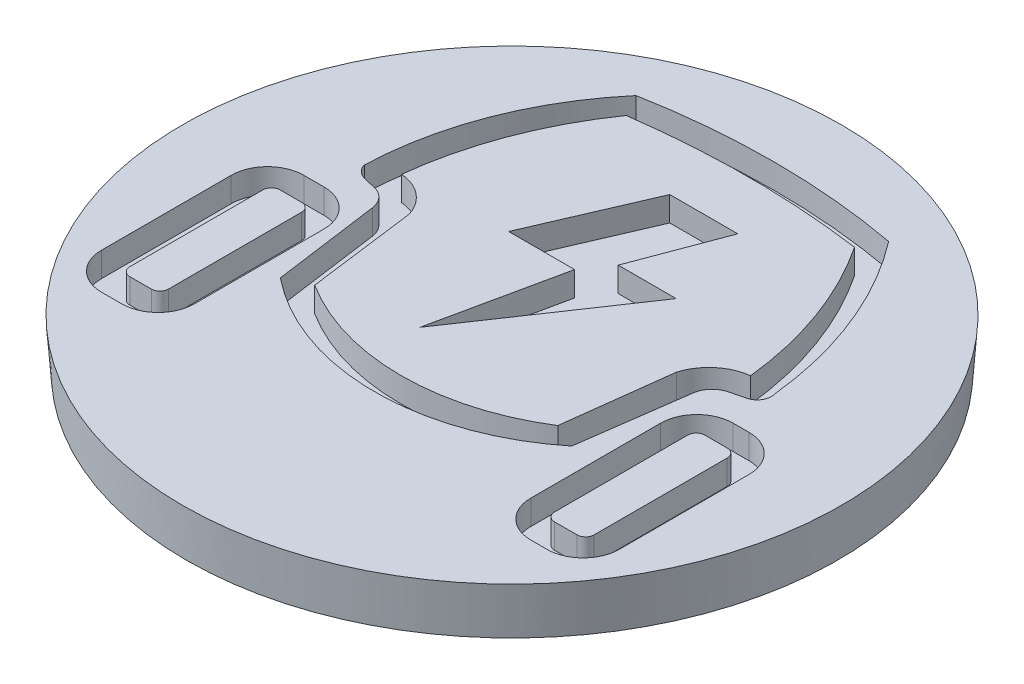
from build123d import *

# Parameters (mm, degrees)
CROQUIS1_R              = 26.25
SALIENTE_EXTRUIR1_DEPTH = 4
CORTAR_EXTRUIR2_DEPTH   = 2
CROQUIS3_R              = 26.75
CROQUIS3_R_2            = 26.25
SALIENTE_EXTRUIR2_DEPTH = 4
CHAFL_N2_SIZE           = 0.3
CHAFL_N2_SIZE_2         = 4


with BuildPart() as part:
    # Croquis1 → Saliente-Extruir1 (new body)
    with BuildSketch(Plane(origin=(0, 0, 0), x_dir=(1, 0, 0), z_dir=(0, 1, 0))):
        with Locations(Location((0, 0, 0), (0, 0, 270))):
            Circle(CROQUIS1_R)
    extrude(amount=SALIENTE_EXTRUIR1_DEPTH)

    # Croquis2 → Cortar-Extruir2 (cut)
    # profile 1 of 4: a face of its own
    with BuildSketch(Plane(origin=(0, 4, 0), x_dir=(1, 0, 0), z_dir=(0, 1, 0))):
        with BuildLine():
            Line((16.577628019, 1.378684251), (17.872942997, 1.378684251))
            ThreePointArc((17.872942997, 1.378684251), (19.958908001, 0.514649256), (20.822942997, -1.571315749))
            Line((20.822942997, -1.571315749), (20.822942997, -12.099082076))
            ThreePointArc((20.822942997, -12.099082076), (19.958908001, -14.18504708), (17.872942997, -15.049082076))
            Line((17.872942997, -15.049082076), (16.577628019, -15.049082076))
            ThreePointArc((16.577628019, -15.049082076), (14.491663014, -14.18504708), (13.627628019, -12.099082076))
            Line((13.627628019, -12.099082076), (13.627628019, -1.571315749))
            ThreePointArc((13.627628019, -1.571315749), (14.491663014, 0.514649256), (16.577628019, 1.378684251))
        make_face()
        with BuildLine():
            ThreePointArc((16.26679092, -0.611177343), (15.771816174, -0.816202597), (15.56679092, -1.311177343))
            Line((15.56679092, -1.311177343), (15.56679092, -12.108932122))
            ThreePointArc((15.56679092, -12.108932122), (15.771816174, -12.603906869), (16.26679092, -12.808932122))
            Line((16.26679092, -12.808932122), (18.08171889, -12.808932122))
            ThreePointArc((18.08171889, -12.808932122), (18.576693636, -12.603906869), (18.78171889, -12.108932122))
            Line((18.78171889, -12.108932122), (18.78171889, -1.311177343))
            ThreePointArc((18.78171889, -1.311177343), (18.576693636, -0.816202597), (18.08171889, -0.611177343))
            Line((18.08171889, -0.611177343), (16.26679092, -0.611177343))
        make_face(mode=Mode.SUBTRACT)
    # profile 2 of 4: a face of its own
    with BuildSketch(Plane(origin=(0, 4, 0), x_dir=(1, 0, 0), z_dir=(0, 1, 0))):
        with BuildLine():
            ThreePointArc((-16.541154267, 4.559666994), (-14.820529985, 13.034857679), (-10.397118387, 20.466064507))
            ThreePointArc((-10.397118387, 20.466064507), (-0.144491455, 21.407214974), (10.108135477, 20.466064507))
            ThreePointArc((10.108135477, 20.466064507), (14.207692764, 13.245645686), (16.196417943, 5.184269249))
            ThreePointArc((16.196417943, 5.184269249), (16.132024065, 4.288372794), (15.452996259, 3.700411684))
            Line((15.452996259, 3.700411684), (14.173141036, 3.380229026))
            ThreePointArc((14.173141036, 3.380229026), (13.270359302, 2.836290622), (12.826889255, 1.880143059))
            Line((12.826889255, 1.880143059), (11.63113204, -6.78360674))
            ThreePointArc((11.63113204, -6.78360674), (-0.193198097, -10.969098115), (-12.017528234, -6.78360674))
            Line((-12.017528234, -6.78360674), (-13.210287359, 1.886657738))
            ThreePointArc((-13.210287359, 1.886657738), (-13.568040347, 2.740473566), (-14.30282929, 3.303566701))
            Line((-14.30282929, 3.303566701), (-15.641463565, 3.64729627))
            ThreePointArc((-15.641463565, 3.64729627), (-16.21669402, 3.979839116), (-16.541154267, 4.559666994))
        make_face()
        with BuildLine():
            ThreePointArc((-9.39054296, 18.667613115), (-0.129607572, 19.310065951), (9.131327816, 18.667613115))
            ThreePointArc((9.131327816, 18.667613115), (12.342092273, 12.334309576), (13.946689107, 5.417300749))
            ThreePointArc((13.946689107, 5.417300749), (11.898739751, 4.524535831), (10.6848875, 2.648985651))
            Line((10.6848875, 2.648985651), (9.622585247, -5.908678465))
            ThreePointArc((9.622585247, -5.908678465), (-0.243319564, -8.757565726), (-10.109224375, -5.908678465))
            Line((-10.109224375, -5.908678465), (-11.267843272, 2.930632851))
            ThreePointArc((-11.267843272, 2.930632851), (-12.439150787, 4.651094628), (-14.374319564, 5.417300749))
            ThreePointArc((-14.374319564, 5.417300749), (-12.712019595, 12.354486023), (-9.39054296, 18.667613115))
        make_face(mode=Mode.SUBTRACT)
    # profile 3 of 4: a face of its own
    with BuildSketch(Plane(origin=(0, 4, 0), x_dir=(1, 0, 0), z_dir=(0, 1, 0))):
        with BuildLine():
            Line((-21.221754159, -1.571315749), (-21.221754159, -12.099082076))
            ThreePointArc((-21.221754159, -12.099082076), (-20.357719163, -14.18504708), (-18.271754159, -15.049082076))
            Line((-18.271754159, -15.049082076), (-16.629915981, -15.049082076))
            ThreePointArc((-16.629915981, -15.049082076), (-14.543950977, -14.18504708), (-13.679915981, -12.099082076))
            Line((-13.679915981, -12.099082076), (-13.679915981, -1.571315749))
            ThreePointArc((-13.679915981, -1.571315749), (-14.543950977, 0.514649256), (-16.629915981, 1.378684251))
            Line((-16.629915981, 1.378684251), (-18.271754159, 1.378684251))
            ThreePointArc((-18.271754159, 1.378684251), (-20.357719163, 0.514649256), (-21.221754159, -1.571315749))
        make_face()
        with BuildLine():
            ThreePointArc((-16.470722605, -12.808932122), (-15.975747858, -12.603906869), (-15.770722605, -12.108932122))
            Line((-15.770722605, -12.108932122), (-15.770722605, -1.311177343))
            ThreePointArc((-15.770722605, -1.311177343), (-15.975747858, -0.816202597), (-16.470722605, -0.611177343))
            Line((-16.470722605, -0.611177343), (-18.213155179, -0.611177343))
            ThreePointArc((-18.213155179, -0.611177343), (-18.708129925, -0.816202597), (-18.913155179, -1.311177343))
            Line((-18.913155179, -1.311177343), (-18.913155179, -12.108932122))
            ThreePointArc((-18.913155179, -12.108932122), (-18.708129925, -12.603906869), (-18.213155179, -12.808932122))
            Line((-18.213155179, -12.808932122), (-16.470722605, -12.808932122))
        make_face(mode=Mode.SUBTRACT)
    # profile 4 of 4: a face of its own
    with BuildSketch(Plane(origin=(0, 4, 0), x_dir=(1, 0, 0), z_dir=(0, 1, 0))):
        Polygon((5.502535459, 7.821900935), (0.799555116, 7.821900935), (3.451735919, 14.875951975), (-2.071830813, 14.875951975), (-6.012416606, 5.739731652), (-0.66220899, 5.739731652), (-2.874648277, -4.596906534), align=None)
    extrude(amount=-CORTAR_EXTRUIR2_DEPTH, mode=Mode.SUBTRACT)

    # Croquis3 → Saliente-Extruir2 (add)
    with BuildSketch(Plane.XZ):
        with Locations(Location((0, 0, 0), (0, 0, 270))):
            Circle(CROQUIS3_R)
        Circle(CROQUIS3_R_2, mode=Mode.SUBTRACT)
    extrude(amount=-SALIENTE_EXTRUIR2_DEPTH)

    # Chaflán2
    # the kernel refuses this chamfer: 4, 0.3 mm, written as the material it takes off along each edge
    with BuildSketch(Plane(origin=(0, 0, 0), x_dir=(0, 0, -1), z_dir=(-1, 0, 0))) as chafl_n2_piece_1:
        Polygon((26.75 - CHAFL_N2_SIZE, 0), (26.75, -CHAFL_N2_SIZE_2), (26.75, 0), align=None)
    revolve(axis=Axis((0, 0, 0), (0, -1, 0)), mode=Mode.SUBTRACT)


solid = part.part
